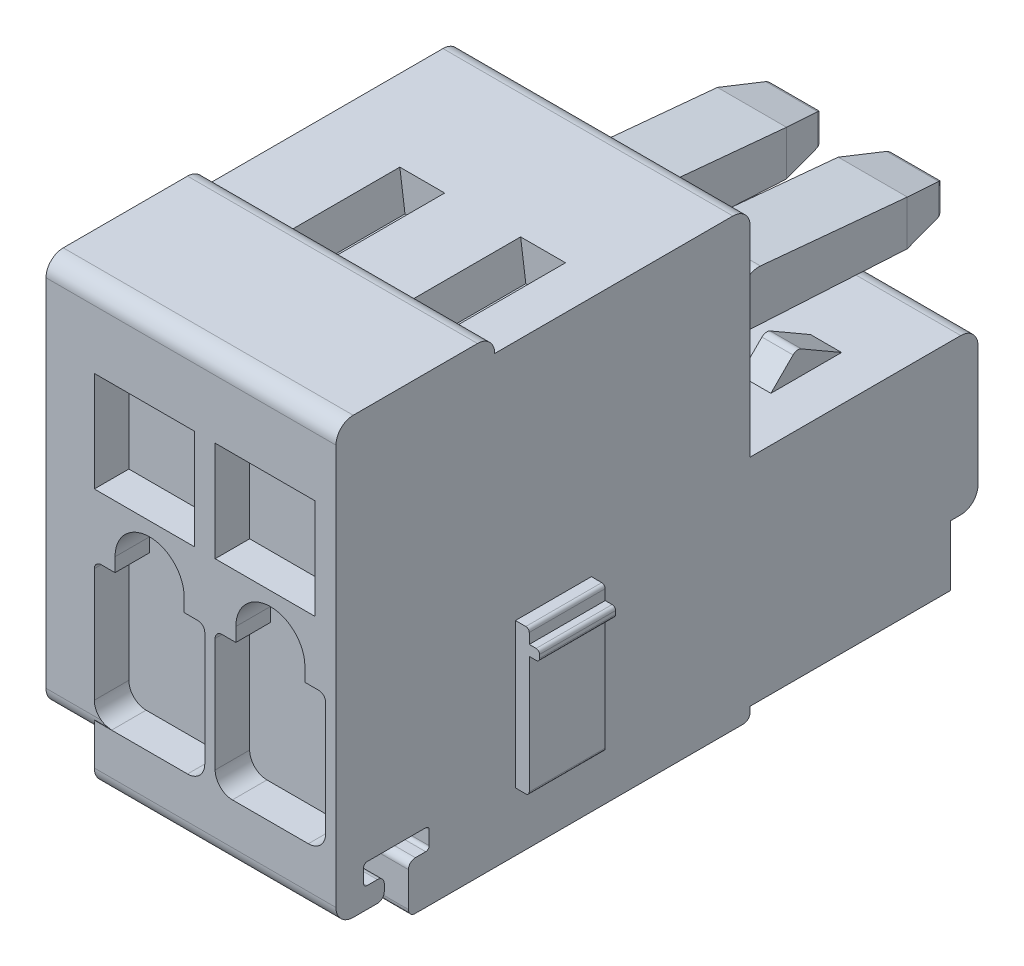
from build123d import *
from OCP.BRepFilletAPI import BRepFilletAPI_MakeChamfer

# Parameters (mm, degrees)
EXTRUDE1_DEPTH              = 3.5
FILLET3_R                   = 0.5
FILLET6_R                   = 0.2
FILLET7_R                   = 0.1
EXTRUDE2_DEPTH              = 1.4
SKETCH3_W                   = 2.9
SKETCH3_H                   = 2.9
EXTRUDE3_DEPTH              = 1
FILLET8_R                   = 0.5
FILLET9_START               = -6
FILLET9_DEPTH               = 2.5
FILLET9_START_2             = -3.5
FILLET9_2_DEPTH             = 7.5
FILLET1_R                   = 0.2
FILLET2_R                   = 0.5
LPATTERN1_START             = 11
LPATTERN1_OUTLINE_W         = 2.9
LPATTERN1_OUTLINE_H         = 2.9
LPATTERN1_DEPTH             = 1
LPATTERN1_START_2           = -4.9000001
LPATTERN1_2_DEPTH           = 2.9000001
EXTRUDE4_DEPTH              = 2.2
FILLET10_R                  = 0.1
SKETCH5_W                   = 5.8
SKETCH5_H                   = 1.75
EXTRUDE5_DEPTH              = 1.7
EXTRUDE6_DEPTH              = 1
EXTRUDE7_DEPTH              = 0.45
EXTRUDE8_START              = -0.65
SKETCH9_W                   = 3.3
SKETCH9_H                   = 1.1
EXTRUDE8_DEPTH              = 1
CHAMFER1_SIZE               = 0.3
FILLET11_R                  = 0.2
CHAMFER2_SIZE               = 1.3
CHAMFER2_SIZE2              = 0.27632353
FILLET12_R                  = 0.2
FILLET13_R                  = 0.5
DRAFT1_ANGLE                = 7.76516602
LPATTERN2_COUNT             = 2
LPATTERN2_PITCH             = 3.5
CHAMFER1_OF_LPATTERN2_SIZE  = 0.3
FILLET11_OF_LPATTERN2_R     = 0.2
CHAMFER2_OF_LPATTERN2_SIZE  = 1.3
CHAMFER2_OF_LPATTERN2_SIZE2 = 0.27632353
FILLET12_OF_LPATTERN2_R     = 0.2
FILLET13_OF_LPATTERN2_R     = 0.5
DRAFT1_OF_LPATTERN2_2_ANGLE = 7.76516602
SKETCH10_R                  = 0.89
EXTRUDE9_DEPTH              = 0.1
SKETCH12_R                  = 1
EXTRUDE10_DEPTH             = 0.1


with BuildPart() as part:
    # Sketch1 → Extrude1 (new, symmetric)
    with BuildSketch(Plane(origin=(0, 0, 0), x_dir=(0, 0, -1), z_dir=(1, 0, 0))):
        Polygon((-7.4, 13.4), (-7.4, 12.91), (-7.4, 12.9), (0, 12.9), (0, 6.6), (6.6, 6.6), (6.6, 2.1), (0, 2.1), (0, 0), (-9.9, 0), (-9.9, 1.4), (-9.3, 1.4), (-9.3, 2), (-11.2, 2), (-11.2, 1.4), (-10.6, 1.4), (-10.6, 0.8), (-12, 0.8), (-12, 13.4), align=None)
    extrude(amount=EXTRUDE1_DEPTH, both=True)

    # Fillet3
    fillet3_edges = [part.edges().sort_by_distance(p)[0] for p in [
        (0, 2.1, -6.6),
        (0, 6.6, -6.6),
        (0, 13.4, 7.4),
        (0, 13.4, 12),
        (0, 0.8, 12),
    ]]
    fillet(fillet3_edges, radius=FILLET3_R - 0.0001)  # a hair under: the kernel refuses the full size

    # Fillet6
    fillet6_edges = [part.edges().sort_by_distance(p)[0] for p in [
        (0, 0, 0),
        (0, 0, 9.9),
        (0, 1.4, 9.9),
        (0, 1.4, 10.6),
        (0, 0.8, 10.6),
    ]]
    fillet(fillet6_edges, radius=FILLET6_R)

    # Fillet7
    fillet7_edges = [part.edges().sort_by_distance(p)[0] for p in [
        (0, 1.4, 9.3),
        (0, 2, 9.3),
        (0, 2, 11.2),
        (0, 1.4, 11.2),
    ]]
    fillet(fillet7_edges, radius=FILLET7_R)

    # Sketch2 → Extrude2 (add)
    with BuildSketch(Plane.ZY.offset(3.5)):
        with BuildLine():
            Line((0, 12.9), (0, 0.5))
            ThreePointArc((0, 0.5), (0.146446609, 0.146446609), (0.5, 0))
            Line((0.5, 0), (9.8, 0))
            Line((9.8, 0), (9.8, 1.2))
            ThreePointArc((9.8, 1.2), (9.770710678, 1.270710678), (9.7, 1.3))
            Line((9.7, 1.3), (9.4, 1.3))
            ThreePointArc((9.4, 1.3), (9.258578644, 1.358578644), (9.2, 1.5))
            Line((9.2, 1.5), (9.2, 1.9))
            ThreePointArc((9.2, 1.9), (9.258578644, 2.041421356), (9.4, 2.1))
            Line((9.4, 2.1), (12, 2.1))
            Line((12, 2.1), (12, 12.9))
            ThreePointArc((12, 12.9), (11.853553391, 13.253553391), (11.5, 13.4))
            Line((11.5, 13.4), (7.9, 13.4))
            ThreePointArc((7.9, 13.4), (7.546446609, 13.253553391), (7.4, 12.9))
            Line((7.4, 12.9), (0, 12.9))
        make_face()
    extrude(amount=EXTRUDE2_DEPTH)

    # Sketch3 → Extrude3 (cut)
    with BuildSketch(Plane.XY.offset(12)):
        with BuildLine():
            Line((0, 6.5), (0, 2.5))
            Line((0, 2.5), (3.2, 2.5))
            Line((3.2, 2.5), (3.2, 6.5))
            Line((3.2, 6.5), (2.6, 6.5))
            Line((2.6, 6.5), (2.6, 6.9))
            ThreePointArc((2.6, 6.9), (1.6, 7.9), (0.6, 6.9))
            Line((0.6, 6.9), (0.6, 6.5))
            Line((0.6, 6.5), (0, 6.5))
        make_face()
        with Locations((1.45, 9.75)):
            Rectangle(SKETCH3_W, SKETCH3_H)
    extrude(amount=-EXTRUDE3_DEPTH, mode=Mode.SUBTRACT)

    # Fillet8
    fillet8_edges = [part.edges().sort_by_distance(p)[0] for p in [
        (-4.2, 2.1, 12),
        (-0.7, 12.9, 0),
    ]]
    fillet(fillet8_edges, radius=FILLET8_R)

    # Fillet9: read off the stored shape, not the designer's step
    # Fillet9 outline → Fillet9 (cut)
    with BuildSketch(Plane.YZ.offset(FILLET9_START)):
        with BuildLine():
            ThreePointArc((0, 9.6), (0.058578644, 9.741421356), (0.2, 9.8))
            Line((0.2, 9.8), (0, 9.8))
            Line((0, 9.8), (0, 9.6))
        make_face()
    extrude(amount=FILLET9_DEPTH, mode=Mode.SUBTRACT)

    # Fillet9 2 outline → Fillet9 2 (cut)
    with BuildSketch(Plane.YZ.offset(FILLET9_START_2)):
        with BuildLine():
            ThreePointArc((0, 9.6), (0.001594061, 9.625200859), (0.006350833, 9.65))
            ThreePointArc((0.006350833, 9.65), (0.001594061, 9.674799142), (0, 9.7))
            Line((0, 9.7), (0, 9.6))
        make_face()
    extrude(amount=FILLET9_2_DEPTH, mode=Mode.SUBTRACT)

    # Fillet1
    fillet1_edges = [part.edges().sort_by_distance(p)[0] for p in [
        (0, 6.5, 11.5),
        (3.2, 6.5, 11.5),
    ]]
    fillet(fillet1_edges, radius=FILLET1_R)

    # Fillet2
    fillet2_edges = [part.edges().sort_by_distance(p)[0] for p in [
        (3.2, 2.5, 11.5),
        (0, 2.5, 11.5),
    ]]
    fillet(fillet2_edges, radius=FILLET2_R)

    # LPattern1: read off the stored shape, not the designer's step
    # LPattern1 outline → LPattern1 (cut)
    with BuildSketch(Plane.XY.offset(LPATTERN1_START)):
        with BuildLine():
            ThreePointArc((-3.5, 3), (-3.353553391, 2.646446609), (-3, 2.5))
            Line((-3, 2.5), (-0.8, 2.5))
            ThreePointArc((-0.8, 2.5), (-0.446446609, 2.646446609), (-0.3, 3))
            Line((-0.3, 3), (-0.3, 6.3))
            ThreePointArc((-0.3, 6.3), (-0.358578644, 6.441421356), (-0.5, 6.5))
            Line((-0.5, 6.5), (-0.9, 6.5))
            Line((-0.9, 6.5), (-0.9, 6.9))
            ThreePointArc((-0.9, 6.9), (-1.9, 7.9), (-2.9, 6.9))
            Line((-2.9, 6.9), (-2.9, 6.5))
            Line((-2.9, 6.5), (-3.3, 6.5))
            ThreePointArc((-3.3, 6.5), (-3.441421356, 6.441421356), (-3.5, 6.3))
            Line((-3.5, 6.3), (-3.5, 3))
        make_face()
        with Locations((-2.05, 9.75)):
            Rectangle(LPATTERN1_OUTLINE_W, LPATTERN1_OUTLINE_H)
    extrude(amount=LPATTERN1_DEPTH, mode=Mode.SUBTRACT)

    # LPattern1 2 outline → LPattern1 2 (cut)
    with BuildSketch(Plane.YZ.offset(LPATTERN1_START_2)):
        with BuildLine():
            ThreePointArc((2.5, 11.989897949), (2.549745519, 11.997468077), (2.6, 12))
            Line((2.6, 12), (2.5, 12))
            Line((2.5, 12), (2.5, 11.989897949))
        make_face()
    extrude(amount=LPATTERN1_2_DEPTH, mode=Mode.SUBTRACT)

    # Sketch4 → Extrude4 (add)
    with BuildSketch(Plane.XY.offset(6.8)):
        Polygon((4.2, 5.2), (4.2, 5.5), (3.9, 5.5), (3.9, 5.9), (3.5, 5.9), (3.5, 1.7), (3.9, 1.7), (3.9, 5.2), align=None)
    extrude(amount=-EXTRUDE4_DEPTH)

    # Fillet10
    fillet10_edges = [part.edges().sort_by_distance(p)[0] for p in [
        (4.2, 5.2, 5.7),
        (3.9, 1.7, 5.7),
        (3.9, 5.9, 5.7),
        (4.2, 5.5, 5.7),
    ]]
    fillet(fillet10_edges, radius=FILLET10_R)

    # Sketch5 → Extrude5 (add)
    with BuildSketch(Plane(origin=(3.5, 0, 0), x_dir=(0, 0, -1), z_dir=(1, 0, 0))):
        with Locations((2.9, 1.225)):
            Rectangle(SKETCH5_W, SKETCH5_H)
    extrude5 = extrude(amount=-EXTRUDE5_DEPTH)

    # Sketch6 → Cut-Revolve1 (revolve, cut)
    with BuildSketch(Plane(origin=(1.75, 0, 0), x_dir=(0, 0, -1), z_dir=(1, 0, 0)), mode=Mode.PRIVATE) as cut_revolve1_sk:
        Polygon((5.5, 3.6), (6.6, 2.85), (6.6, 4.35), (5.3, 4.35), (5.3, 3.6), align=None)
    cut_revolve1 = revolve(cut_revolve1_sk.sketch.rotate(Axis((1.75, 4.35, -8.210841518), (0, 0, 1)), 270), axis=Axis((1.75, 4.35, -8.210841518), (0, 0, 1)), mode=Mode.SUBTRACT)

    # Sketch7 → Extrude6 (add, symmetric)
    with BuildSketch(Plane(origin=(1.75, 0, 0), x_dir=(0, 0, -1), z_dir=(1, 0, 0))):
        Polygon((5.3, 8.8), (0, 9.1), (0, 10.2), (0.541742431, 10.2), (0.573734732, 10.54205115), (5.3, 10.1), (6.6, 9.75166605), (6.6, 8.913735263), align=None)
    extrude6 = extrude(amount=EXTRUDE6_DEPTH, both=True)

    # Sketch8 → Extrude7 (add, symmetric)
    with BuildSketch(Plane(origin=(1.75, 0, 0), x_dir=(0, 0, -1), z_dir=(1, 0, 0))):
        Polygon((3.948868116, 6.6), (1.9, 6.6), (2.64993778, 7.34993778), align=None)
    extrude7 = extrude(amount=EXTRUDE7_DEPTH, both=True)

    # Sketch9 → Extrude8 (cut)
    with BuildSketch(Plane(origin=(1.75, 0, 0), x_dir=(0, 0, -1), z_dir=(1, 0, 0)).offset(EXTRUDE8_START)):
        with Locations((-5.75, 12.35)):
            Rectangle(SKETCH9_W, SKETCH9_H)
    extrude8 = extrude(amount=EXTRUDE8_DEPTH, mode=Mode.SUBTRACT)

    # Chamfer1
    chamfer1_edges = [part.edges().sort_by_distance(p)[0] for p in [
        (1.75, 10.2, 0),
    ]]
    chamfer(chamfer1_edges, length=CHAMFER1_SIZE)

    # Fillet11
    fillet11_edges = [part.edges().sort_by_distance(p)[0] for p in [
        (1.75, 9.1, 0),
    ]]
    fillet(fillet11_edges, radius=FILLET11_R)

    # Chamfer2: one chamfer whose edges measure the first distance from different faces: ONE call of the kernel's chamfer builder (chamfer() names one face for all edges)
    chamfer2_edges_1 = [part.edges().sort_by_distance(p)[0] for p in [
        (0.75, 9.332700656, -6.6),
    ]]
    chamfer2_side_1 = [part.faces().sort_by_distance(p)[0] for p in [
        (0.75, 9.597309804, -3.160314049),
    ]]
    chamfer2_edges_2 = [part.edges().sort_by_distance(p)[0] for p in [
        (2.75, 9.332700656, -6.6),
    ]]
    chamfer2_side_2 = [part.faces().sort_by_distance(p)[0] for p in [
        (2.75, 9.597309804, -3.160314049),
    ]]
    chamfer2 = BRepFilletAPI_MakeChamfer(part.part.solid().wrapped)
    for e in chamfer2_edges_1:
        chamfer2.Add(CHAMFER2_SIZE, CHAMFER2_SIZE2, e.wrapped, chamfer2_side_1[0].wrapped)  # the first distance lies on this face
    for e in chamfer2_edges_2:
        chamfer2.Add(CHAMFER2_SIZE, CHAMFER2_SIZE2, e.wrapped, chamfer2_side_2[0].wrapped)  # the first distance lies on this face
    add(Compound.cast(chamfer2.Shape()), mode=Mode.REPLACE)

    # Fillet12
    fillet12_edges = [part.edges().sort_by_distance(p)[0] for p in [
        (1.75, 7.34993778, -2.64993778),
        (1.75, 9.75166605, -6.6),
        (1.75, 8.913735263, -6.6),
        (2.47367647, 9.332700656, -6.6),
        (1.02632353, 9.332700656, -6.6),
    ]]
    fillet(fillet12_edges, radius=FILLET12_R)

    # Fillet13
    # the kernel refuses this fillet: 0.5 mm, written as the material it takes off along each edge
    with BuildSketch(Plane(origin=(3.937227673, 10.54205115, -0.573734732), x_dir=(0, -0.09312431420176691, -0.9956544893206933), z_dir=(-1, 0, 0))) as fillet13_piece_1:
        with BuildLine():
            CenterArc((0.474891069, 0.5), FILLET13_R, 198.234806166, 71.765193834)
            Line((0, 0.343544024), (-0.009497821, 0.340414905))
            ThreePointArc((-0.009497821, 0.340414905), (-0.01, 0.171772012), (-0.01, 0))
            Line((-0.01, 0), (0, -0.01))
            Line((0, -0.01), (0.474891069, -0.01))
            Line((0.474891069, -0.01), (0.474891069, 0))
        make_face()
    extrude(amount=4.374455346, mode=Mode.SUBTRACT)

    # Draft1
    draft1_faces = [part.faces().sort_by_distance(p)[0] for p in [
        (2.1, 12.35, 5.75),
        (1.1, 12.35, 5.75),
    ]]
    draft(draft1_faces, Plane(origin=(2.1, 11.8, 7.4), x_dir=(0, 0, 1), z_dir=(0, 1, 0)), DRAFT1_ANGLE)

    # LPattern2: Extrude5, Cut-Revolve1, Extrude6, Extrude7, Extrude8 ×2
    with Locations(*[(-i * LPATTERN2_PITCH, 0, 0) for i in range(1, LPATTERN2_COUNT)]):
        add(extrude5)
        add(cut_revolve1, mode=Mode.SUBTRACT)
        add(extrude6)
        add(extrude7)
        add(extrude8, mode=Mode.SUBTRACT)

    # Chamfer1 of LPattern2
    chamfer1_of_lpattern2_edges = [part.edges().sort_by_distance(p)[0] for p in [
        (-1.75, 10.2, 0),
    ]]
    chamfer(chamfer1_of_lpattern2_edges, length=CHAMFER1_OF_LPATTERN2_SIZE)

    # Fillet11 of LPattern2
    fillet11_of_lpattern2_edges = [part.edges().sort_by_distance(p)[0] for p in [
        (-1.75, 9.1, 0),
    ]]
    fillet(fillet11_of_lpattern2_edges, radius=FILLET11_OF_LPATTERN2_R)

    # Chamfer2 of LPattern2: one chamfer whose edges measure the first distance from different faces: ONE call of the kernel's chamfer builder (chamfer() names one face for all edges)
    chamfer2_of_lpattern2_edges_1 = [part.edges().sort_by_distance(p)[0] for p in [
        (-2.75, 9.332700656, -6.6),
    ]]
    chamfer2_of_lpattern2_side_1 = [part.faces().sort_by_distance(p)[0] for p in [
        (-2.75, 9.597309804, -3.160314049),
    ]]
    chamfer2_of_lpattern2_edges_2 = [part.edges().sort_by_distance(p)[0] for p in [
        (-0.75, 9.332700656, -6.6),
    ]]
    chamfer2_of_lpattern2_side_2 = [part.faces().sort_by_distance(p)[0] for p in [
        (-0.75, 9.597309804, -3.160314049),
    ]]
    chamfer2_of_lpattern2 = BRepFilletAPI_MakeChamfer(part.part.solid().wrapped)
    for e in chamfer2_of_lpattern2_edges_1:
        chamfer2_of_lpattern2.Add(CHAMFER2_OF_LPATTERN2_SIZE, CHAMFER2_OF_LPATTERN2_SIZE2, e.wrapped, chamfer2_of_lpattern2_side_1[0].wrapped)  # the first distance lies on this face
    for e in chamfer2_of_lpattern2_edges_2:
        chamfer2_of_lpattern2.Add(CHAMFER2_OF_LPATTERN2_SIZE, CHAMFER2_OF_LPATTERN2_SIZE2, e.wrapped, chamfer2_of_lpattern2_side_2[0].wrapped)  # the first distance lies on this face
    add(Compound.cast(chamfer2_of_lpattern2.Shape()), mode=Mode.REPLACE)

    # Fillet12 of LPattern2
    fillet12_of_lpattern2_edges = [part.edges().sort_by_distance(p)[0] for p in [
        (-1.75, 7.34993778, -2.64993778),
        (-1.75, 9.75166605, -6.6),
        (-1.75, 8.913735263, -6.6),
        (-1.02632353, 9.332700656, -6.6),
        (-2.47367647, 9.332700656, -6.6),
    ]]
    fillet(fillet12_of_lpattern2_edges, radius=FILLET12_OF_LPATTERN2_R)

    # Fillet13 of LPattern2
    # the kernel refuses this fillet: 0.5 mm, written as the material it takes off along each edge
    with BuildSketch(Plane(origin=(0.437227673, 10.54205115, -0.573734732), x_dir=(0, -0.09312431420176691, -0.9956544893206933), z_dir=(-1, 0, 0))) as fillet13_of_lpattern2_piece_1:
        with BuildLine():
            CenterArc((0.474891069, 0.5), FILLET13_OF_LPATTERN2_R, 198.234806166, 71.765193834)
            Line((0, 0.343544024), (-0.009497821, 0.340414905))
            ThreePointArc((-0.009497821, 0.340414905), (-0.01, 0.171772012), (-0.01, 0))
            Line((-0.01, 0), (0, -0.01))
            Line((0, -0.01), (0.474891069, -0.01))
            Line((0.474891069, -0.01), (0.474891069, 0))
        make_face()
    extrude(amount=4.374455346, mode=Mode.SUBTRACT)

    # Draft1 of LPattern2 2
    draft1_of_lpattern2_2_faces = [part.faces().sort_by_distance(p)[0] for p in [
        (-1.4, 12.35, 5.75),
        (-2.4, 12.35, 5.75),
    ]]
    draft(draft1_of_lpattern2_2_faces, Plane(origin=(-1.4, 11.8, 7.4), x_dir=(0, 0, 1), z_dir=(0, 1, 0)), DRAFT1_OF_LPATTERN2_2_ANGLE)

    # Sketch10 → Extrude9 (add)
    with BuildSketch(Plane.ZY.offset(4.9)):
        with Locations((1.3, 11.7)):
            Circle(SKETCH10_R)
    extrude9 = extrude(amount=EXTRUDE9_DEPTH)

    # Sketch-Pattern1: Extrude9 at 3 more places
    with Locations((0, 0, 1.8), (0, 0.5, 7.3), (0, 0.5, 9.2)):
        add(extrude9)

    # Sketch12 → Extrude10 (add)
    with BuildSketch(Plane.ZY.offset(4.9)):
        with Locations((1.3, 1.4)):
            Circle(SKETCH12_R)
    extrude10 = extrude(amount=EXTRUDE10_DEPTH)

    # Sketch-Pattern2: Extrude10 at 2 more places
    with Locations((0, 0, 3.1), (0, 0, 6.4)):
        add(extrude10)


solid = part.part
